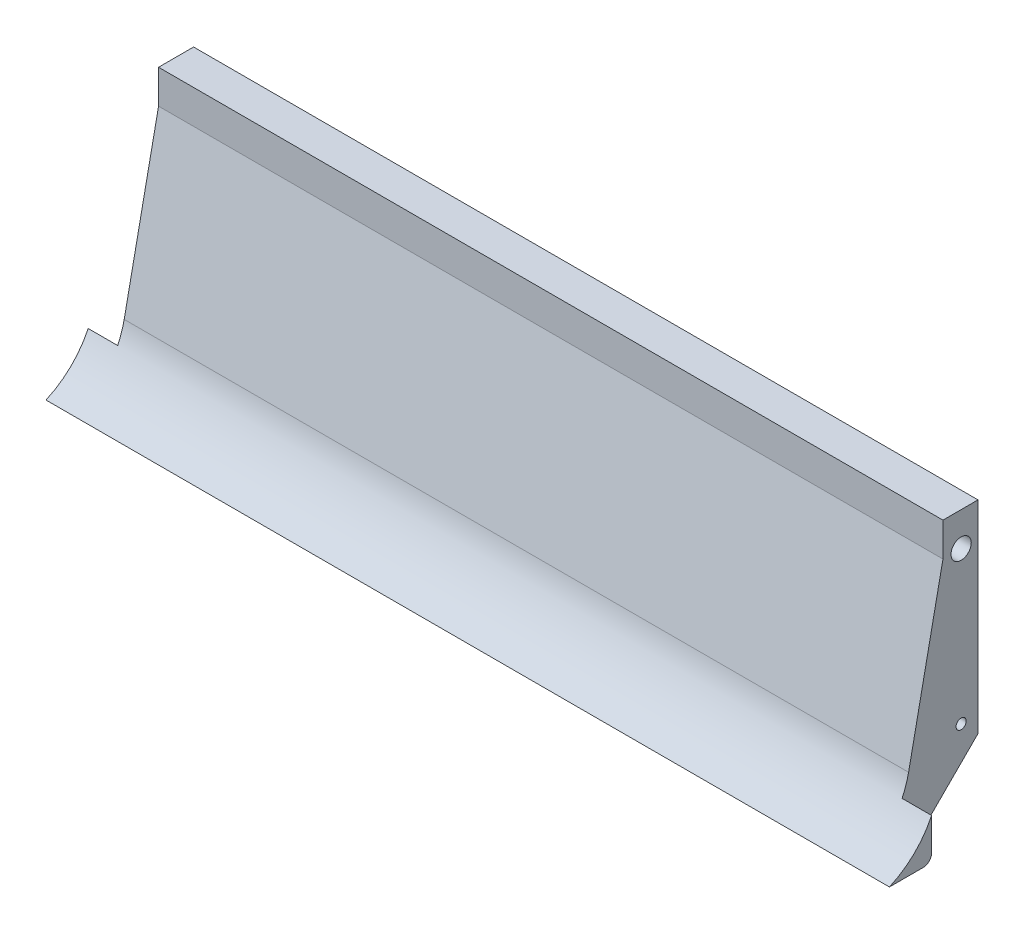
from build123d import *

# Parameters (mm, degrees)
SKETCH1_W           = 14
SKETCH1_H           = 27
BOSS_EXTRUDE1_DEPTH = 100
CUT_EXTRUDE1_DEPTH  = 100
FILLET1_R           = 10
SKETCH4_W           = 98.852101938
SKETCH4_H           = 4.155908349
BOSS_EXTRUDE2_DEPTH = 4
SKETCH5_R           = 1.2
SKETCH5_R_2         = 0.6
CUT_EXTRUDE2_DEPTH  = 100
CHAMFER1_SIZE       = 7
SKETCH6_W           = 4.155908349
SKETCH6_H           = 24
CUT_EXTRUDE3_DEPTH  = 3.5
SKETCH8_W           = 1.147898062
SKETCH8_H           = 4.155908349
BOSS_EXTRUDE3_DEPTH = 4
SKETCH9_W           = 4.155908349
SKETCH9_H           = 24
CUT_EXTRUDE4_DEPTH  = 3.5
SKETCH10_W          = 10.233519384
SKETCH10_H          = 31.339386183
CUT_EXTRUDE5_DEPTH  = 3.5
SKETCH11_W          = 18.924548437
SKETCH11_H          = 36.127134787
CUT_EXTRUDE7_DEPTH  = 3.5
FILLET2_R           = 5
FILLET5_R           = 1
FILLET6_R           = 1


with BuildPart() as part:
    # Sketch1 → Boss-Extrude1 (new body)
    with BuildSketch(Plane(origin=(0, 0, 0), x_dir=(0, 0, -1), z_dir=(1, 0, 0))):
        with Locations((-13.07263952, 3.302202671)):
            Rectangle(SKETCH1_W, SKETCH1_H)
    extrude(amount=BOSS_EXTRUDE1_DEPTH)

    # Sketch2 → Cut-Extrude1 (cut)
    with BuildSketch(Plane(origin=(100, 0, 0), x_dir=(0, 0, -1), z_dir=(1, 0, 0))):
        Polygon((-20.07263952, -10.197797329), (-15.511656896, -8.952001224), (-10.228547869, 16.802202671), (-20.07263952, 16.802202671), align=None)
    extrude(amount=-CUT_EXTRUDE1_DEPTH, mode=Mode.SUBTRACT)

    # Fillet1
    # the kernel refuses this fillet: 10 mm, written as the material it adds along each edge
    with BuildSketch(Plane(origin=(100, -8.952001224, 15.511656896), x_dir=(0, 0.9796012375346099, -0.20095127623546138), z_dir=(-1, 0, 0))) as fillet1_piece_1_section:
        with BuildLine():
            CenterArc((6.021748433, -10), FILLET1_R, 90, 54.673150745)
            Line((-2.136918685, -4.217599905), (-2.300092028, -4.101951904))
            ThreePointArc((-2.300092028, -4.101951904), (-1.246866474, -2.018406947), (-0.178407131, 0.090393006))
            Line((-0.178407131, 0.090393006), (0, 0.2))
            Line((0, 0.2), (6.021748433, 0.2))
            Line((6.021748433, 0.2), (6.021748433, 0))
        make_face()
    fillet1_piece_1 = extrude(amount=100, mode=Mode.PRIVATE)
    fillet1_piece_1 = split(fillet1_piece_1, bisect_by=Plane(origin=(50, -10.197797329, 16.270514602), z_dir=(0, 1, 0)), keep=Keep.TOP, mode=Mode.PRIVATE)
    add(fillet1_piece_1)

    # Sketch4 → Boss-Extrude2 (add)
    with BuildSketch(Plane(origin=(0, 16.802202671, 0), x_dir=(1, 0, 0), z_dir=(0, 1, 0))):
        with Locations((50.573949031, -8.150593694)):
            Rectangle(SKETCH4_W, SKETCH4_H)
    extrude(amount=BOSS_EXTRUDE2_DEPTH)

    # Sketch5 → Cut-Extrude2 (cut)
    with BuildSketch(Plane(origin=(100, 0, 0), x_dir=(0, 0, -1), z_dir=(1, 0, 0))):
        with Locations((-8.07263952, 16.802202671)):
            Circle(SKETCH5_R)
        with Locations((-8.07263952, -1.197797329)):
            Circle(SKETCH5_R_2)
    extrude(amount=-CUT_EXTRUDE2_DEPTH, mode=Mode.SUBTRACT)

    # Chamfer1
    chamfer1_edges = [part.edges().sort_by_distance(p)[0] for p in [
        (50, -10.197797329, 6.07263952),
    ]]
    chamfer(chamfer1_edges, length=CHAMFER1_SIZE)

    # Sketch6 → Cut-Extrude3 (cut)
    with BuildSketch(Plane(origin=(100, 0, 0), x_dir=(0, 0, -1), z_dir=(1, 0, 0))):
        with Locations((-8.150593694, 8.802202671)):
            Rectangle(SKETCH6_W, SKETCH6_H)
    extrude(amount=-CUT_EXTRUDE3_DEPTH, mode=Mode.SUBTRACT)

    # Sketch8 → Boss-Extrude3 (add)
    with BuildSketch(Plane(origin=(0, 16.802202671, 0), x_dir=(1, 0, 0), z_dir=(0, 1, 0))):
        with Locations((0.573949031, -8.150593694)):
            Rectangle(SKETCH8_W, SKETCH8_H)
    extrude(amount=BOSS_EXTRUDE3_DEPTH)

    # Sketch9 → Cut-Extrude4 (cut)
    with BuildSketch(Plane.ZY):
        with Locations((8.150593694, 8.802202671)):
            Rectangle(SKETCH9_W, SKETCH9_H)
    extrude(amount=-CUT_EXTRUDE4_DEPTH, mode=Mode.SUBTRACT)

    # Sketch10 → Cut-Extrude5 (cut)
    with BuildSketch(Plane.ZY):
        with Locations((9.955879828, 5.471895763)):
            Rectangle(SKETCH10_W, SKETCH10_H)
    extrude(amount=-CUT_EXTRUDE5_DEPTH, mode=Mode.SUBTRACT)

    # Sketch11 → Cut-Extrude7 (cut)
    with BuildSketch(Plane(origin=(100, 0, 0), x_dir=(0, 0, -1), z_dir=(1, 0, 0))):
        with Locations((-5.610365301, 7.865770065)):
            Rectangle(SKETCH11_W, SKETCH11_H)
    extrude(amount=-CUT_EXTRUDE7_DEPTH, mode=Mode.SUBTRACT)

    # Fillet2
    fillet2_edges = [part.edges().sort_by_distance(p)[0] for p in [
        (50, -10.197797329, 13.07263952),
    ]]
    fillet(fillet2_edges, radius=FILLET2_R)

    # Fillet5
    # the kernel refuses this fillet: 1 mm, written as the material it takes off along each edge
    with BuildSketch(Plane(origin=(102.500000319, -10.19729224, 15.07263952), x_dir=(0, -0.0005050888353824425, 0.9999998724426261), z_dir=(-1, 0, 0))) as fillet5_piece_1:
        with BuildLine():
            CenterArc((0.999495039, 0.999999872), FILLET5_R, 180.02893946, 90)
            Line((-0.000504834, 0.999494784), (-0.100504821, 0.999444275))
            Line((-0.100504821, 0.999444275), (-0.099999987, -5.0509e-05))
            Line((-0.099999987, -5.0509e-05), (-0.001370852, -0.099990603))
            ThreePointArc((-0.001370852, -0.099990603), (0.071118567, -0.100469181), (1.000050636, -0.099999987))
            Line((1.000050636, -0.099999987), (1.000000128, 0))
        make_face()
    extrude(amount=6.000000319, mode=Mode.SUBTRACT)

    # Fillet6
    # the kernel refuses this fillet: 1 mm, written as the material it takes off along each edge
    with BuildSketch(Plane(origin=(-2.500000319, -10.19729224, 15.07263952), x_dir=(0, 1, 0), z_dir=(1, 0, 0))) as fillet6_piece_1:
        with BuildLine():
            CenterArc((0.999494911, 1), FILLET6_R, 180, 90)
            Line((-0.000505089, 1), (-0.100505089, 1))
            ThreePointArc((-0.100505089, 1), (-0.100505089, 0.071067812), (-0.099989898, -0.001421356))
            Line((-0.099989898, -0.001421356), (0, -0.1))
            Line((0, -0.1), (0.999494911, -0.1))
            Line((0.999494911, -0.1), (0.999494911, 0))
        make_face()
    extrude(amount=6.000000319, mode=Mode.SUBTRACT)


solid = part.part
